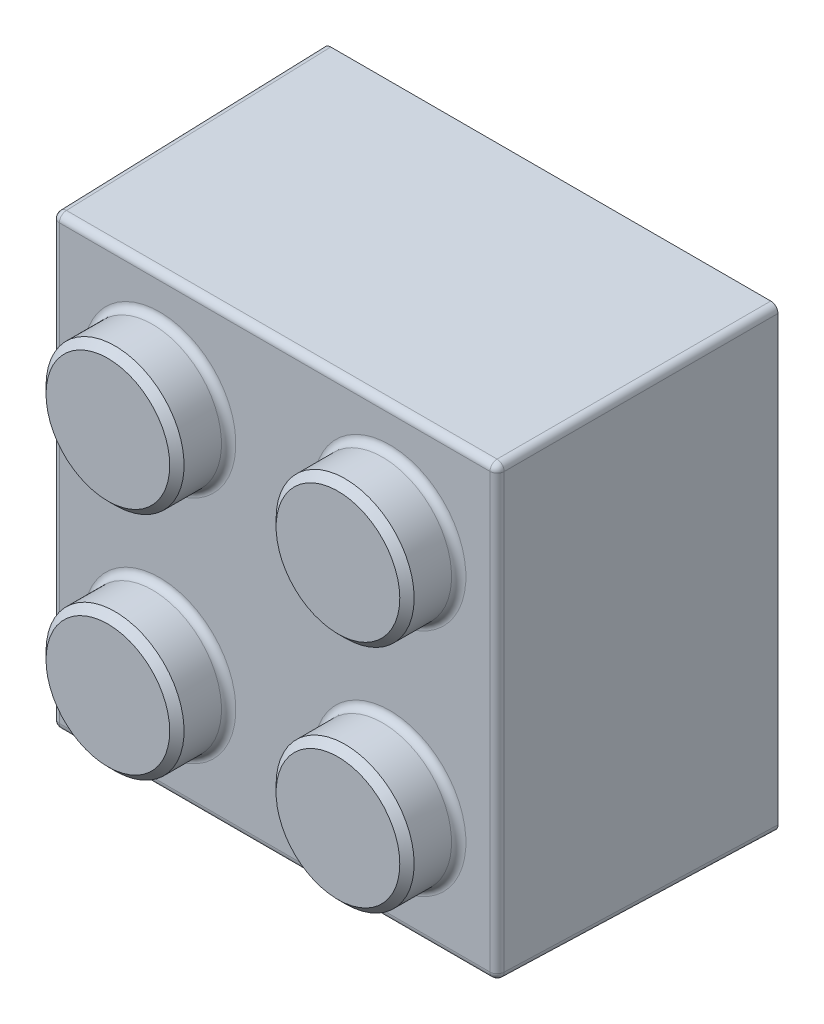
from build123d import *

# Parameters (mm, degrees)
SKETCH1_W                  = 15.8
SKETCH1_H                  = 15.9
BOSS_EXTRUDE1_DEPTH        = 9.6
BOSS_EXTRUDE1_TAPER        = 1
SKETCH2_R                  = 2.4
BOSS_EXTRUDE2_DEPTH        = 1.8
CHAMFER1_SIZE              = 0.25
LPATTERN1_COUNT            = 2
LPATTERN1_PITCH            = 8
LPATTERN1_COUNT_DIR2       = 2
LPATTERN1_PITCH_DIR2       = 8
CHAMFER1_OF_LPATTERN1_SIZE = 0.25
SHELL1_OUTLINE_R           = 1.2
SHELL1_DEPTH               = 10.2
FILLET1_R                  = 0.25
RIB2_START                 = -0.3
RIB2_DEPTH                 = 0.6
RIB3_START                 = -0.3
RIB3_DEPTH                 = 0.6
LPATTERN2_COUNT            = 2
LPATTERN2_PITCH            = 8.1
LPATTERN3_COUNT            = 2
LPATTERN3_PITCH            = 8.1
MIRROR1_START              = -0.3
MIRROR1_COPY_1_DEPTH       = 0.6
MIRROR2_START              = -0.3
MIRROR2_COPY_1_DEPTH       = 0.6
SKETCH5_R                  = 2.95
SKETCH5_R_2                = 2.15
BOSS_EXTRUDE3_DEPTH        = 8.4
BOSS_EXTRUDE3_DRAFT        = 2


with BuildPart() as part:
    # Sketch1 → Boss-Extrude1 (new body)
    with BuildSketch(Plane.XY):
        with Locations((7.9, 7.95)):
            Rectangle(SKETCH1_W, SKETCH1_H)
    extrude(amount=BOSS_EXTRUDE1_DEPTH, taper=BOSS_EXTRUDE1_TAPER)

    # Sketch2 → Boss-Extrude2 (add)
    with BuildSketch(Plane.XY.offset(9.6)):
        with Locations(Location((3.9, 3.9, 0), (0, 0, 180))):
            Circle(SKETCH2_R)
    boss_extrude2 = extrude(amount=BOSS_EXTRUDE2_DEPTH)

    # Chamfer1
    chamfer1_edges = [part.edges().sort_by_distance(p)[0] for p in [
        (6.3, 3.9, 11.4),
    ]]
    chamfer(chamfer1_edges, length=CHAMFER1_SIZE)

    # LPattern1: Boss-Extrude2 2 × 2
    with Locations(*[(j * LPATTERN1_PITCH_DIR2, i * LPATTERN1_PITCH, 0) for i in range(LPATTERN1_COUNT) for j in range(LPATTERN1_COUNT_DIR2) if (i, j) != (0, 0)]):
        add(boss_extrude2)

    # Chamfer1 of LPattern1
    chamfer1_of_lpattern1_edges = [part.edges().sort_by_distance(p)[0] for p in [
        (14.3, 3.9, 11.4),
        (6.3, 11.9, 11.4),
        (14.3, 11.9, 11.4),
    ]]
    chamfer(chamfer1_of_lpattern1_edges, length=CHAMFER1_OF_LPATTERN1_SIZE)

    # Shell1: read off the stored shape, not the designer's step
    # Shell1 outline → Shell1 (cut)
    with BuildSketch(Plane.XY):
        with Locations((11.9, 11.9)):
            Circle(SHELL1_OUTLINE_R)
        with Locations((11.9, 3.9)):
            Circle(SHELL1_OUTLINE_R)
        with Locations((3.9, 3.9)):
            Circle(SHELL1_OUTLINE_R)
        with Locations((3.9, 11.9)):
            Circle(SHELL1_OUTLINE_R)
    extrude(amount=SHELL1_DEPTH, mode=Mode.SUBTRACT)

    # Shell1 2: loft between two sections, ruled curve by curve
    shell1_2_from = [
        Edge.make_line((1.346805339, 14.553194661, 8.4), (1.346805339, 1.346805339, 8.4)),
        Edge.make_line((1.346805339, 1.346805339, 8.4), (14.453194661, 1.346805339, 8.4)),
        Edge.make_line((14.453194661, 1.346805339, 8.4), (14.453194661, 14.553194661, 8.4)),
        Edge.make_line((14.453194661, 14.553194661, 8.4), (1.346805339, 14.553194661, 8.4)),
    ]
    shell1_2_to = [
        Edge.make_line((1.200182794, 14.699817206, 0), (1.200182794, 1.200182794, 0)),
        Edge.make_line((1.200182794, 1.200182794, 0), (14.599817206, 1.200182794, 0)),
        Edge.make_line((14.599817206, 1.200182794, 0), (14.599817206, 14.699817206, 0)),
        Edge.make_line((14.599817206, 14.699817206, 0), (1.200182794, 14.699817206, 0)),
    ]
    shell1_2 = Solid(Shell([*[Face.make_surface_from_curves(shell1_2_from[k], shell1_2_to[k]) for k in range(4)], Face(Wire(shell1_2_from)), Face(Wire(shell1_2_to))]))
    add(shell1_2, mode=Mode.SUBTRACT)

    # Fillet1
    fillet1_edges = [part.edges().sort_by_distance(p)[0] for p in [
        (15.632431377, 7.95, 9.6),
        (6.3, 3.9, 9.6),
        (7.9, 15.732431377, 9.6),
        (6.3, 11.9, 9.6),
        (14.3, 3.9, 9.6),
        (14.3, 11.9, 9.6),
        (0.167568623, 7.95, 9.6),
        (0.083784312, 15.816215688, 4.8),
        (15.716215688, 15.816215688, 4.8),
        (15.716215688, 0.083784312, 4.8),
        (0.083784312, 0.083784312, 4.8),
        (7.9, 0.167568623, 9.6),
    ]]
    fillet(fillet1_edges, radius=FILLET1_R)

    # Rib2: read off the stored shape, not the designer's step
    # Rib2 outline → Rib2 (add)
    with BuildSketch(Plane(origin=(0, 3.9, 0), x_dir=(1, 0, 0), z_dir=(0, 1, 0)).offset(RIB2_START)):
        Polygon((14.599817206, 0), (14.299817206, 0), (14.299817206, -8.4), (14.453194661, -8.4), align=None)
    rib2 = extrude(amount=RIB2_DEPTH)

    # Rib3: read off the stored shape, not the designer's step
    # Rib3 outline → Rib3 (add)
    with BuildSketch(Plane(origin=(3.9, 0, 0), x_dir=(0, 0, -1), z_dir=(1, 0, 0)).offset(RIB3_START)):
        Polygon((0, 1.200182794), (0, 1.500731453), (-8.4, 1.500731453), (-8.4, 1.346805339), align=None)
    rib3 = extrude(amount=RIB3_DEPTH)

    # LPattern2: Rib2 ×2
    with Locations(*[(0, i * LPATTERN2_PITCH, 0) for i in range(1, LPATTERN2_COUNT)]):
        add(rib2)

    # LPattern3: Rib3 ×2
    with Locations(*[(i * LPATTERN3_PITCH, 0, 0) for i in range(1, LPATTERN3_COUNT)]):
        add(rib3)

    # Mirror1: Rib3 across plane
    add(rib3.mirror(Plane.ZX.offset(7.95)))

    # Mirror1 copy 1 sketch → Mirror1 copy 1 (add)
    with BuildSketch(Plane(origin=(12, 15.9, 0), x_dir=(0, 0, -1), z_dir=(1, 0, 0)).offset(MIRROR1_START)):
        Polygon((0, -1.200182794), (0, -1.500731453), (-8.4, -1.500731453), (-8.4, -1.346805339), align=None)
    extrude(amount=MIRROR1_COPY_1_DEPTH)

    # Mirror2: Rib2 across plane
    add(rib2.mirror(Plane(origin=(7.9, 0, 0), x_dir=(0, 0, 1), z_dir=(1, 0, 0))))

    # Mirror2 copy 1 sketch → Mirror2 copy 1 (add)
    with BuildSketch(Plane(origin=(15.8, 12, 0), x_dir=(-1, 0, 0), z_dir=(0, 1, 0)).offset(MIRROR2_START)):
        Polygon((14.599817206, 0), (14.299817206, 0), (14.299817206, 8.4), (14.453194661, 8.4), align=None)
    extrude(amount=MIRROR2_COPY_1_DEPTH)


with BuildPart() as boss_extrude3_tool:
    # Sketch5 → Boss-Extrude3 (with draft: the straight prism first)
    with BuildSketch(Plane(origin=(0, 0, 0), x_dir=(-1, 0, 0), z_dir=(0, 0, -1))):
        with Locations((-7.9, 7.95)):
            Circle(SKETCH5_R)
        with Locations((-7.9, 7.95)):
            Circle(SKETCH5_R_2, mode=Mode.SUBTRACT)
    extrude(amount=-BOSS_EXTRUDE3_DEPTH)
    # Boss-Extrude3: the draft: its side faces are tilted about the plane it starts from
    boss_extrude3_sides = [boss_extrude3_tool.faces().sort_by_distance(p)[0] for p in [
        (10.85, 7.95, 4.2),
        (10.05, 7.95, 4.2),
    ]]
    draft(boss_extrude3_sides, Plane(origin=(0, 0, 0), x_dir=(-1, 0, 0), z_dir=(0, 0, -1)), BOSS_EXTRUDE3_DRAFT)


with BuildPart() as part_1:
    add(part.part)

    # Boss-Extrude3: add boss_extrude3_tool
    add(boss_extrude3_tool.part)


solid = part_1.part
